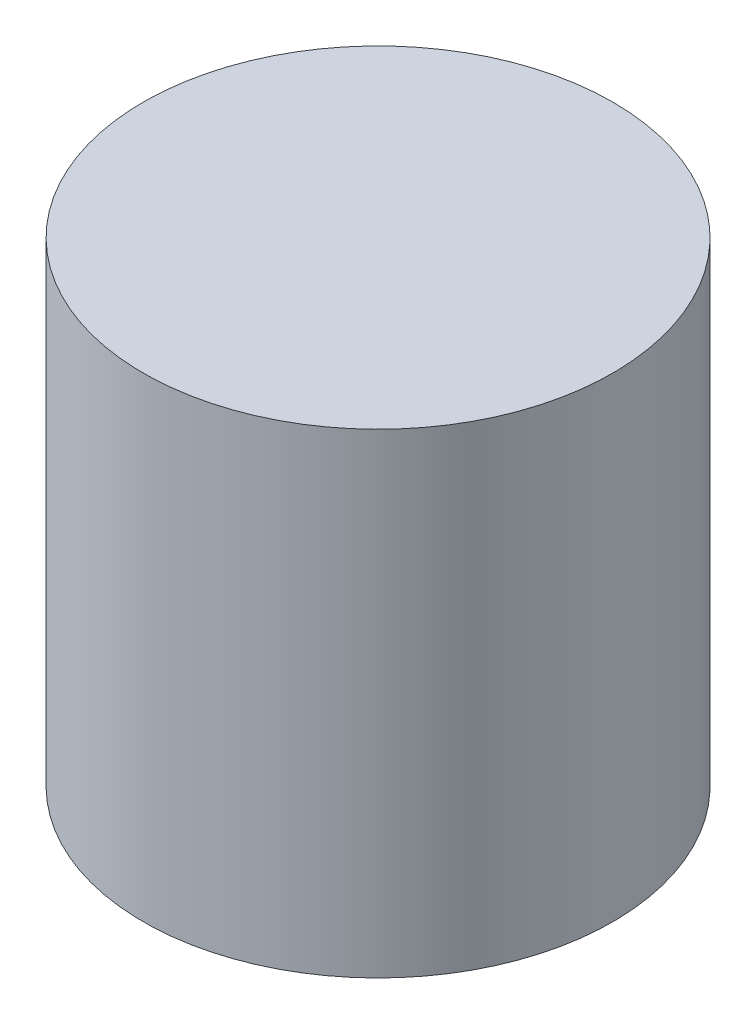
from build123d import *

# Parameters (mm, degrees)
SKETCH1_R           = 3.1242
BOSS_EXTRUDE1_DEPTH = 6.3246


with BuildPart() as part:
    # Sketch1 → Boss-Extrude1 (new body)
    with BuildSketch(Plane(origin=(0, 0, 0), x_dir=(1, 0, 0), z_dir=(0, 1, 0))):
        Circle(SKETCH1_R)
    extrude(amount=BOSS_EXTRUDE1_DEPTH)


solid = part.part
